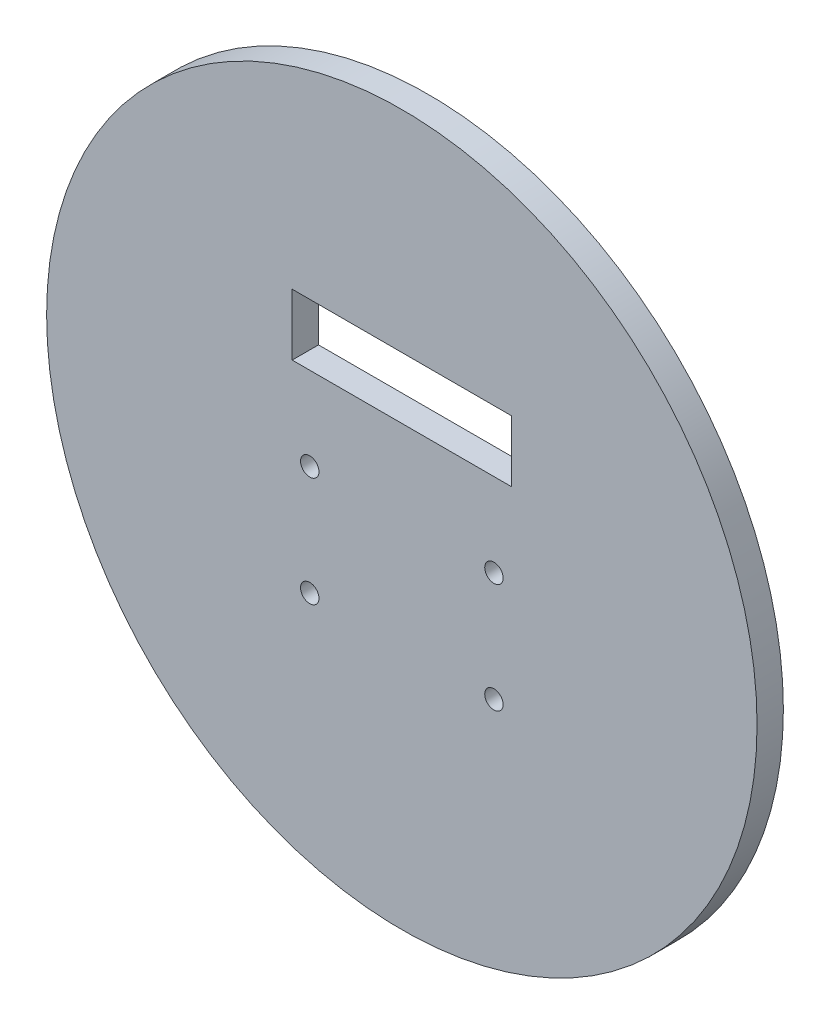
from build123d import *

# Parameters (mm, degrees)
ESQUISSE1_R                  = 40.5
ESQUISSE1_R_2                = 1.05
BOSS_EXTRU_1_DEPTH           = 3
ESQUISSE2_W                  = 25
ESQUISSE2_H                  = 7
ENL_V_MAT_EXTRU_4_DEPTH      = 14
BOSS_EXTRU_6_DEPTH           = 2
ENL_V_MAT_EXTRU_5_DEPTH      = 2
ESQUISSE2_9_W                = 25
ESQUISSE2_9_H                = 18.5
BOSS_EXTRU_7_DEPTH           = 2
ENL_V_MAT_EXTRU_6_DEPTH      = 58.354162883
ENL_V_MAT_EXTRU_6_DEPTH_BACK = 58.354162883
ESQUISSE7_R                  = 1.05


with BuildPart() as part:
    # Esquisse1 → Boss.-Extru.1 (new body)
    with BuildSketch(Plane.XY):
        Circle(ESQUISSE1_R)
        with Locations((-10.5, -12.5)):
            Circle(ESQUISSE1_R_2, mode=Mode.SUBTRACT)
        with Locations((10.5, -12.5)):
            Circle(ESQUISSE1_R_2, mode=Mode.SUBTRACT)
        with Locations((-10.5, 0)):
            Circle(ESQUISSE1_R_2, mode=Mode.SUBTRACT)
        with Locations((10.5, 0)):
            Circle(ESQUISSE1_R_2, mode=Mode.SUBTRACT)
    extrude(amount=BOSS_EXTRU_1_DEPTH)

    # Esquisse2 → Enlèv. mat.-Extru.4 (cut)
    with BuildSketch(Plane.XY):
        with Locations((0, 13)):
            Rectangle(ESQUISSE2_W, ESQUISSE2_H)
    extrude(amount=ENL_V_MAT_EXTRU_4_DEPTH, mode=Mode.SUBTRACT)

    # Esquisse2<7> → Boss.-Extru.6 (add)
    with BuildSketch(Plane.XY):
        Polygon((12.5, 4), (12.5, 9.5), (-12.5, 9.5), (-12.5, 4), (0, 4), align=None)
    extrude(amount=-BOSS_EXTRU_6_DEPTH)

    # Esquisse2<8> → Enlèv. mat.-Extru.5 (cut)
    with BuildSketch(Plane.XY):
        Polygon((12.5, 4), (12.5, 9.5), (-12.5, 9.5), (-12.5, 4), (0, 4), align=None)
    extrude(amount=-ENL_V_MAT_EXTRU_5_DEPTH, mode=Mode.SUBTRACT)

    # Esquisse2<9> → Boss.-Extru.7 (add)
    with BuildSketch(Plane.XY):
        with Locations((0, -5.25)):
            Rectangle(ESQUISSE2_9_W, ESQUISSE2_9_H)
    extrude(amount=-BOSS_EXTRU_7_DEPTH)

    # Esquisse7 → Enlèv. mat.-Extru.6 (cut, two sides: drawn at the far end of the back side and taken through both)
    with BuildSketch(Plane.XY.offset(-ENL_V_MAT_EXTRU_6_DEPTH_BACK)):
        with Locations((-10.5, 0)):
            Circle(ESQUISSE7_R)
        with Locations((-10.5, -12.5)):
            Circle(ESQUISSE7_R)
        with Locations((10.5, 0)):
            Circle(ESQUISSE7_R)
        with Locations((10.5, -12.5)):
            Circle(ESQUISSE7_R)
    extrude(amount=ENL_V_MAT_EXTRU_6_DEPTH + ENL_V_MAT_EXTRU_6_DEPTH_BACK, mode=Mode.SUBTRACT)


solid = part.part
